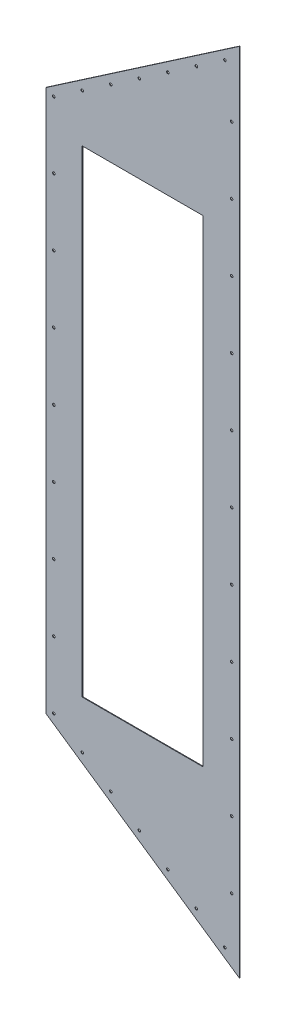
from build123d import *

# Parameters (mm, degrees)
BRIDA_BASE1_DEPTH            = 1.5875
TALADRO_DE_MARGEN_PARA_M61_D = 6.6
CROQUIS7_W                   = 314.97561102
CROQUIS7_H                   = 1242.8481637
CORTAR_EXTRUIR2_DEPTH        = 3200


# Sheet-metal steps are written as plain solids
with BuildPart() as part:
    # Croquis1 → Brida base1 (new body)
    with BuildSketch(Plane.XY):
        Polygon((-251.585, -706), (251.585, -1050.4), (251.585, -706), (251.585, 706), (251.585, 1050.4), (-251.585, 706), align=None)
    extrude(amount=-BRIDA_BASE1_DEPTH)

    # Taladro de margen para M61 (through all)
    with Locations(Plane.XY):
        with Locations((-231.585, 695.452987896), (-157.316935544, 746.288552238), (-83.048871087, 797.124116579), (-8.780806631, 847.95968092), (65.487257826, 898.795245261), (139.755322282, 949.630809603), (214.023386739, 1000.466373944), (65.487257826, -898.795245261), (-8.780806631, -847.95968092), (-83.048871087, -797.124116579), (-157.316935544, -746.288552238), (-231.585, -695.452987896), (214.023386739, -1000.466373944), (139.755322282, -949.630809603), (-231.585, -521.452987896), (-231.585, -347.452987896), (-231.585, -173.452987896), (-231.585, 0.547012104), (-231.585, 174.547012104), (-231.585, 348.547012104), (-231.585, 522.547012104), (231.585, 522.547012104), (231.585, 348.547012104), (231.585, 174.547012104), (231.585, 0.547012104), (231.585, -173.452987896), (231.585, -347.452987896), (231.585, -521.452987896), (231.585, -695.452987896), (231.585, -869.452987896), (231.585, 696.547012104), (231.585, 870.547012104)):
            Hole(TALADRO_DE_MARGEN_PARA_M61_D / 2)

    # Croquis7 → Cortar-Extruir2 (cut)
    with BuildSketch(Plane.XY.offset(-1.5875)):
        Rectangle(CROQUIS7_W, CROQUIS7_H)
    extrude(amount=CORTAR_EXTRUIR2_DEPTH, mode=Mode.SUBTRACT)


solid = part.part
